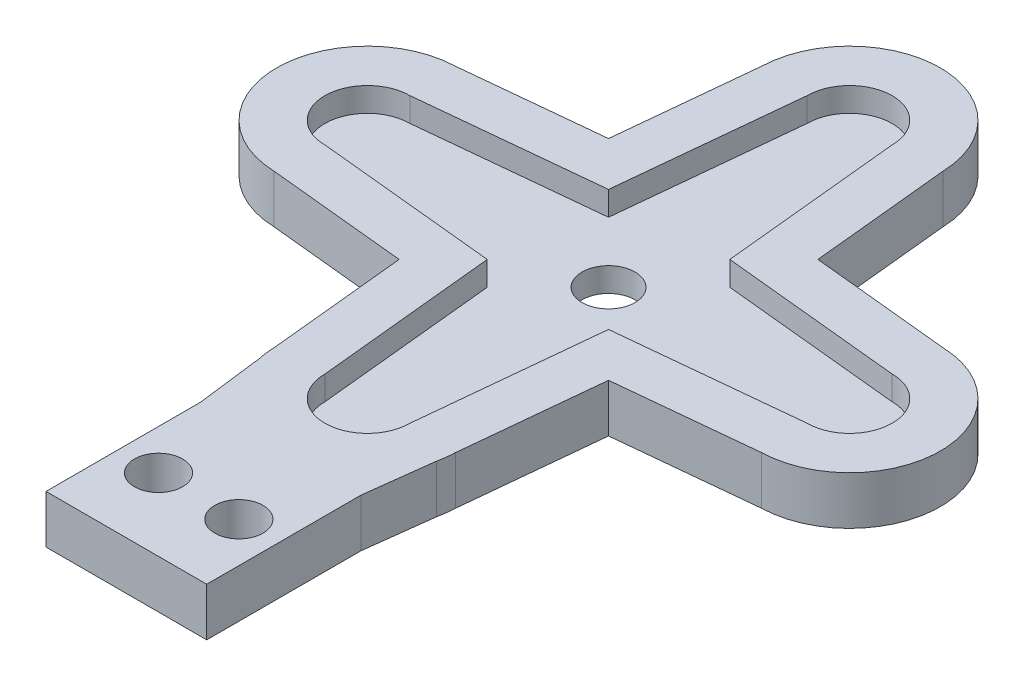
from build123d import *
from build123d.topology import SkipClean

# Parameters (mm, degrees)
SKETCH1_R               = 21
BOSS_EXTRUDE1_DEPTH     = 1.5
SKETCH2_R               = 2.65
CUT_EXTRUDE1_DEPTH      = 1.5
SKETCH5_W               = 10
SKETCH5_H               = 30
BOSS_EXTRUDE2_DEPTH     = 1.5
CIRPATTERN1_DEPTH       = 1.5
CUT_EXTRUDE4_REACH      = 38.65
SKETCH4_R               = 1.65
CUT_EXTRUDE5_REACH      = 38.742
SKETCH6_R               = 1.5
CUT_EXTRUDE6_DEPTH      = 37.650375169
CUT_EXTRUDE6_DEPTH_BACK = 37.650375169


# Read off the part's stored shape, not the designer's step: CirPattern1
with BuildPart() as part:
    # Sketch1 → Boss-Extrude1 (new, symmetric)
    with BuildSketch(Plane(origin=(0, 0, 0), x_dir=(1, 0, 0), z_dir=(0, 1, 0))):
        with Locations(Location((0, 0, 0), (0, 0, 270))):
            Circle(SKETCH1_R)
    extrude(amount=BOSS_EXTRUDE1_DEPTH, both=True)

    # Sketch2 → Cut-Extrude1 (cut)
    with BuildSketch(Plane(origin=(0, 1.5, 0), x_dir=(1, 0, 0), z_dir=(0, 1, 0))):
        with Locations((0, -15)):
            Circle(SKETCH2_R)
        with BuildLine():
            ThreePointArc((-2.65, -15), (0, -12.35), (2.65, -15))
            Line((2.65, -15), (4.067821782, -0.821782178))
            ThreePointArc((4.067821782, -0.821782178), (0, -4.15), (-4.067821782, -0.821782178))
            Line((-4.067821782, -0.821782178), (-2.65, -15))
        make_face()
        with BuildLine():
            ThreePointArc((-4.067821782, -0.821782178), (0, -4.15), (4.067821782, -0.821782178))
            Line((4.067821782, -0.821782178), (4.15, 0))
            ThreePointArc((4.15, 0), (0, 4.15), (-4.15, 0))
            Line((-4.15, 0), (-4.067821782, -0.821782178))
        make_face()
    cut_extrude1 = extrude(amount=-CUT_EXTRUDE1_DEPTH, mode=Mode.SUBTRACT)

    # Sketch5 → Boss-Extrude2 (add, symmetric)
    with BuildSketch(Plane(origin=(0, 0, 0), x_dir=(1, 0, 0), z_dir=(0, 1, 0))):
        with Locations((0, -15)):
            Rectangle(SKETCH5_W, SKETCH5_H)
    extrude(amount=BOSS_EXTRUDE2_DEPTH, both=True)

    # Mirror1: Cut-Extrude1 across plane
    with SkipClean():  # the faces are left unmerged after this step: merging them gives an invalid solid
        add(cut_extrude1.mirror(Plane.XY), mode=Mode.SUBTRACT)

    # CirPattern1 outline → CirPattern1 (cut)
    with BuildSketch(Plane(origin=(0, 0, 0), x_dir=(1, 0, 0), z_dir=(0, 1, 0))):
        with BuildLine():
            Line((3.772727273, -3.772727273), (15, -2.65))
            ThreePointArc((15, -2.65), (17.65, 0), (15, 2.65))
            Line((15, 2.65), (3.772727273, 3.772727273))
            Line((3.772727273, 3.772727273), (4.067821782, 0.821782178))
            ThreePointArc((4.067821782, 0.821782178), (0, -4.15), (-4.067821782, 0.821782178))
            Line((-4.067821782, 0.821782178), (-3.772727273, 3.772727273))
            Line((-3.772727273, 3.772727273), (-15, 2.65))
            ThreePointArc((-15, 2.65), (-17.65, 0), (-15, -2.65))
            Line((-15, -2.65), (-3.772727273, -3.772727273))
            Line((-3.772727273, -3.772727273), (-2.65, -15))
            ThreePointArc((-2.65, -15), (0, -17.65), (2.65, -15))
            Line((2.65, -15), (3.772727273, -3.772727273))
        make_face()
    extrude(amount=CIRPATTERN1_DEPTH, mode=Mode.SUBTRACT)

    # Sketch4 → Cut-Extrude4 (cut, up to next)
    with BuildSketch(Plane(origin=(0, 0, 0), x_dir=(1, 0, 0), z_dir=(0, 1, 0)), mode=Mode.PRIVATE) as cut_extrude4_sk1:
        with Locations(Location((0, 0, 0), (0, 0, 270))):
            Circle(SKETCH4_R)
    cut_extrude4_tool1 = extrude(cut_extrude4_sk1.sketch, amount=-CUT_EXTRUDE4_REACH, mode=Mode.PRIVATE) & part.part
    add(cut_extrude4_tool1.solids().sort_by_distance((0, 0, 0))[0], mode=Mode.SUBTRACT)

    # Sketch6 → Cut-Extrude5 (cut, up to next)
    with BuildSketch(Plane(origin=(0, 1.5, 0), x_dir=(1, 0, 0), z_dir=(0, 1, 0)), mode=Mode.PRIVATE) as cut_extrude5_sk1:
        with Locations(Location((2.5, -25.5, 0), (0, 0, 270))):
            Circle(SKETCH6_R)
    cut_extrude5_tool1 = extrude(cut_extrude5_sk1.sketch, amount=-CUT_EXTRUDE5_REACH, mode=Mode.PRIVATE) & part.part
    # Sketch6 → Cut-Extrude5 (cut, up to next)
    with BuildSketch(Plane(origin=(0, 1.5, 0), x_dir=(1, 0, 0), z_dir=(0, 1, 0)), mode=Mode.PRIVATE) as cut_extrude5_sk2:
        with Locations(Location((-2.5, -25.5, 0), (0, 0, 270))):
            Circle(SKETCH6_R)
    cut_extrude5_tool2 = extrude(cut_extrude5_sk2.sketch, amount=-CUT_EXTRUDE5_REACH, mode=Mode.PRIVATE) & part.part
    add(cut_extrude5_tool1.solids().sort_by_distance((2.5, 1.5, 25.5))[0], mode=Mode.SUBTRACT)
    add(cut_extrude5_tool2.solids().sort_by_distance((-2.5, 1.5, 25.5))[0], mode=Mode.SUBTRACT)

    # Sketch7 → Cut-Extrude6 (cut, two sides: drawn at the far end of the back side and taken through both)
    with BuildSketch(Plane(origin=(0, 0, 0), x_dir=(1, 0, 0), z_dir=(0, 1, 0)).offset(-CUT_EXTRUDE6_DEPTH_BACK)):
        with BuildLine():
            ThreePointArc((5, -20.396078054), (0, 21), (-5, -20.396078054))
            Line((-5, -20.396078054), (-5.519486194, -16.207382355))
            ThreePointArc((-5.519486194, -16.207382355), (-5.607043009, -15.695391034), (-5.647210443, -15.177522436))
            Line((-5.647210443, -15.177522436), (-6.513602442, -6.513602442))
            Line((-6.513602442, -6.513602442), (-15.177522436, -5.647210443))
            ThreePointArc((-15.177522436, -5.647210443), (-20.65, 0), (-15.177522436, 5.647210443))
            Line((-15.177522436, 5.647210443), (-6.513602442, 6.513602442))
            Line((-6.513602442, 6.513602442), (-5.647210443, 15.177522436))
            ThreePointArc((-5.647210443, 15.177522436), (0, 20.65), (5.647210443, 15.177522436))
            Line((5.647210443, 15.177522436), (6.513602442, 6.513602442))
            Line((6.513602442, 6.513602442), (15.177522436, 5.647210443))
            ThreePointArc((15.177522436, 5.647210443), (20.65, 0), (15.177522436, -5.647210443))
            Line((15.177522436, -5.647210443), (6.513602442, -6.513602442))
            Line((6.513602442, -6.513602442), (5.647210443, -15.177522436))
            ThreePointArc((5.647210443, -15.177522436), (5.607043009, -15.695391034), (5.519486194, -16.207382355))
            Line((5.519486194, -16.207382355), (5, -20.396078054))
        make_face()
    extrude(amount=CUT_EXTRUDE6_DEPTH + CUT_EXTRUDE6_DEPTH_BACK, mode=Mode.SUBTRACT)


solid = part.part
